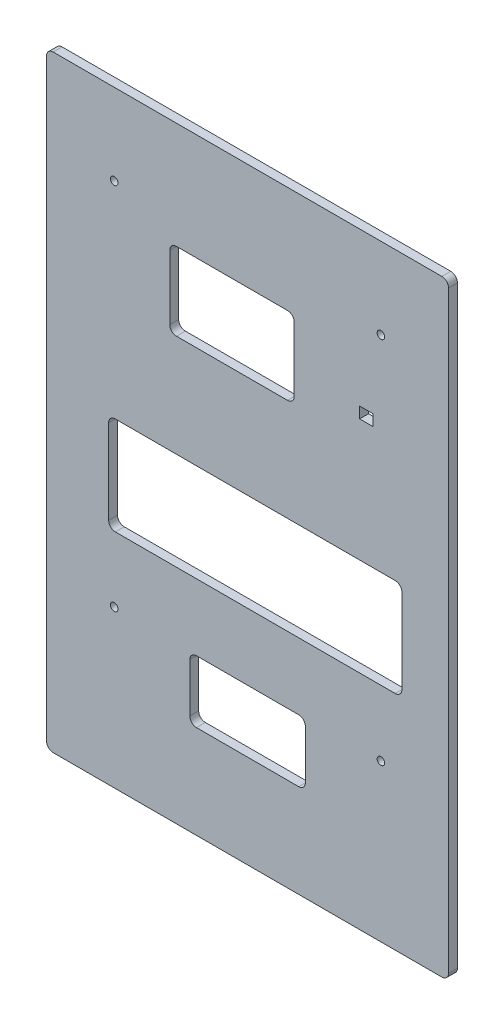
from build123d import *

# Parameters (mm, degrees)
ESQUISSE1_W        = 180.86
ESQUISSE1_H        = 273
ESQUISSE1_R        = 1.5
ESQUISSE1_W_2      = 52
ESQUISSE1_H_2      = 28
ESQUISSE1_W_3      = 131.93
ESQUISSE1_H_3      = 44
ESQUISSE1_W_4      = 56
ESQUISSE1_H_4      = 35
ESQUISSE1_W_5      = 6
ESQUISSE1_H_5      = 5
BOSS_EXTRU_1_DEPTH = 4
D_GAGEMENT_M31_D   = 3.4
CONG_1_R           = 3


with BuildPart() as part:
    # Esquisse1 → Boss.-Extru.1 (new body)
    with BuildSketch(Plane.XY):
        with Locations((90.43, 136.5)):
            Rectangle(ESQUISSE1_W, ESQUISSE1_H)
        with Locations((30.43, 236.5)):
            Circle(ESQUISSE1_R, mode=Mode.SUBTRACT)
        with Locations((150.43, 236.5)):
            Circle(ESQUISSE1_R, mode=Mode.SUBTRACT)
        with Locations((30.43, 70.5)):
            Circle(ESQUISSE1_R, mode=Mode.SUBTRACT)
        with Locations((150.43, 70.5)):
            Circle(ESQUISSE1_R, mode=Mode.SUBTRACT)
        with Locations((90.43, 56)):
            Rectangle(ESQUISSE1_W_2, ESQUISSE1_H_2, mode=Mode.SUBTRACT)
        with Locations((93.895, 122)):
            Rectangle(ESQUISSE1_W_3, ESQUISSE1_H_3, mode=Mode.SUBTRACT)
        with Locations((83.43, 207.5)):
            Rectangle(ESQUISSE1_W_4, ESQUISSE1_H_4, mode=Mode.SUBTRACT)
        with Locations((143.86, 201.5)):
            Rectangle(ESQUISSE1_W_5, ESQUISSE1_H_5, mode=Mode.SUBTRACT)
    extrude(amount=BOSS_EXTRU_1_DEPTH)

    # Dégagement M31 (through all)
    with Locations(Plane.XY.offset(4)):
        with Locations((30.43, 236.5), (150.43, 236.5), (150.43, 70.5), (30.43, 70.5)):
            Hole(D_GAGEMENT_M31_D / 2)

    # Congé1
    cong_1_edges = [part.edges().sort_by_distance(p)[0] for p in [
        (0, 0, 2),
        (180.86, 0, 2),
        (116.43, 42, 2),
        (64.43, 42, 2),
        (116.43, 70, 2),
        (64.43, 70, 2),
        (159.86, 100, 2),
        (27.93, 100, 2),
        (159.86, 144, 2),
        (27.93, 144, 2),
        (180.86, 273, 2),
        (0, 273, 2),
        (111.43, 190, 2),
        (111.43, 225, 2),
        (55.43, 225, 2),
        (55.43, 190, 2),
    ]]
    fillet(cong_1_edges, radius=CONG_1_R)


solid = part.part
